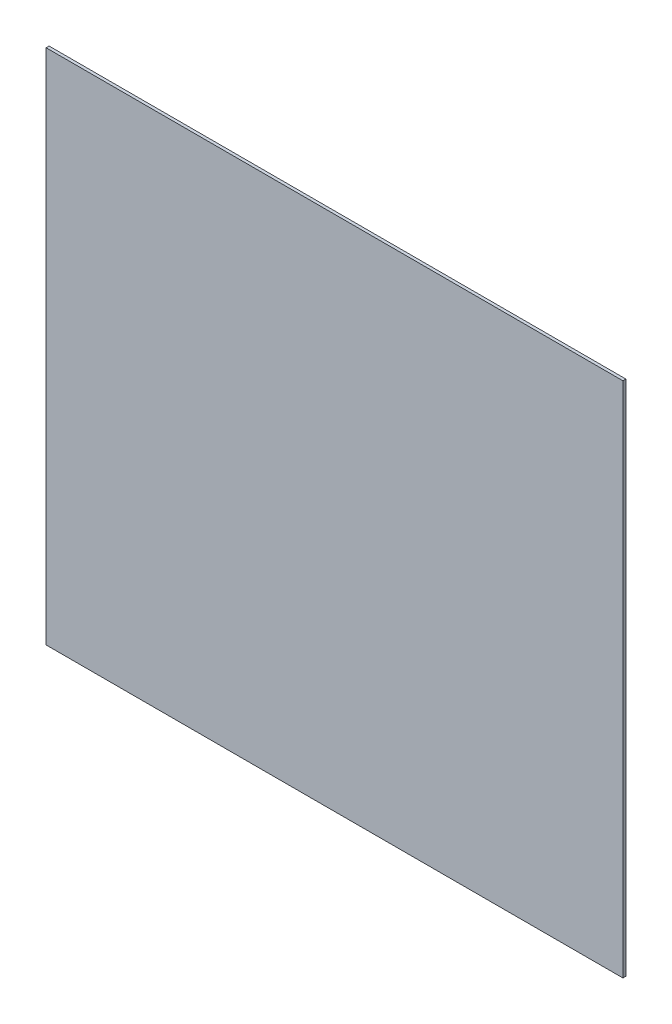
from build123d import *

# Parameters (mm, degrees)
IZIM1_W            = 580
IZIM1_H            = 520
TABAN_FLAN_1_DEPTH = 3


# Sheet-metal steps are written as plain solids
with BuildPart() as part:
    # Çizim1 → Taban-Flanş1 (new body)
    with BuildSketch(Plane.XY):
        with Locations((290, -260)):
            Rectangle(IZIM1_W, IZIM1_H)
    extrude(amount=-TABAN_FLAN_1_DEPTH)


solid = part.part
